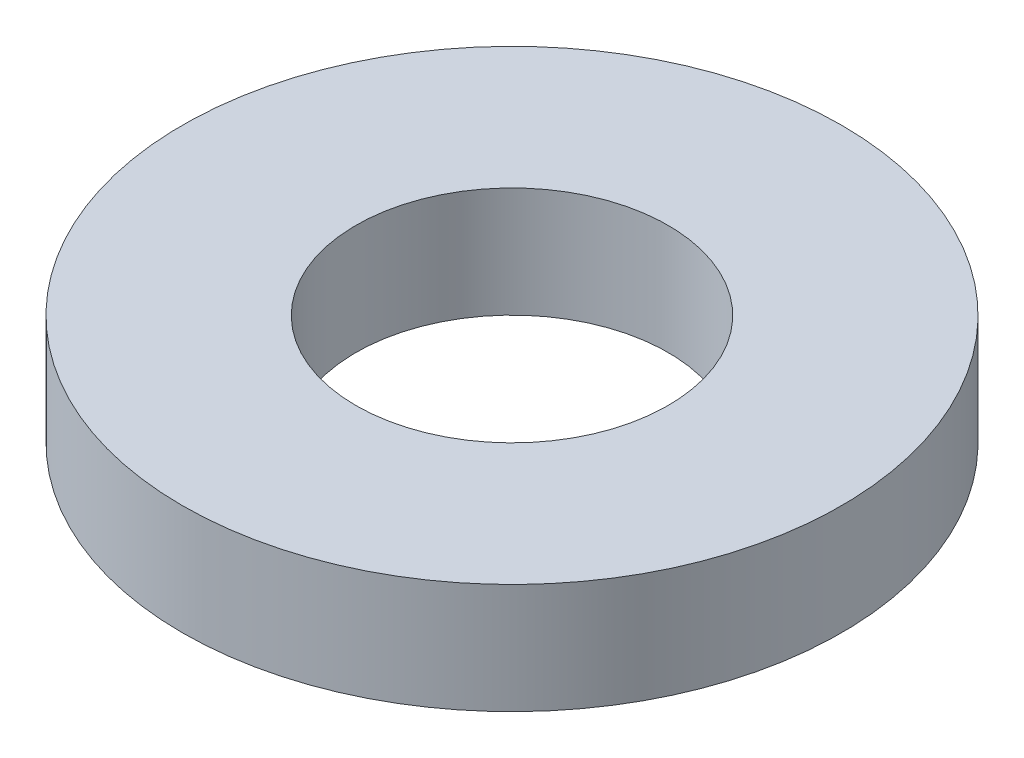
from build123d import *

# Parameters (mm, degrees)
SKETCH1_R           = 4.75
SKETCH1_R_2         = 2.25
BOSS_EXTRUDE1_DEPTH = 1.5875


with BuildPart() as part:
    # Sketch1 → Boss-Extrude1 (new body)
    with BuildSketch(Plane(origin=(0, 0, 0), x_dir=(1, 0, 0), z_dir=(0, 1, 0))):
        Circle(SKETCH1_R)
        Circle(SKETCH1_R_2, mode=Mode.SUBTRACT)
    extrude(amount=BOSS_EXTRUDE1_DEPTH)


solid = part.part
